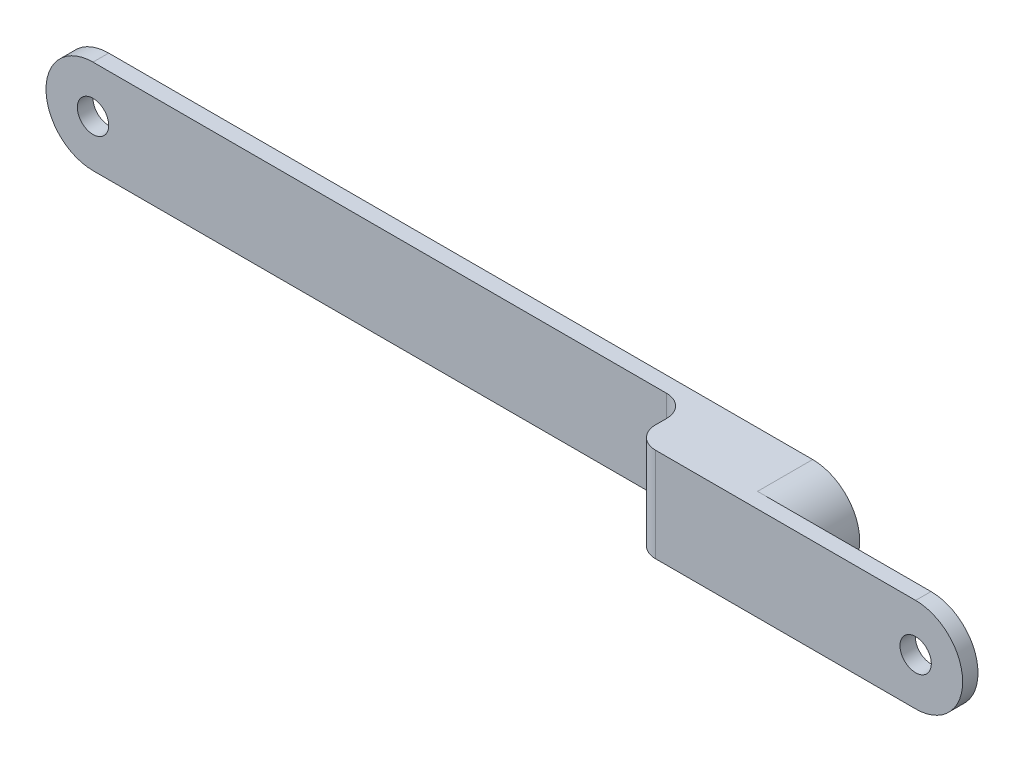
from build123d import *

# Parameters (mm, degrees)
BOSS_EXTRUDE1_DEPTH = 45
SKETCH2_R           = 5
CUT_EXTRUDE1_DEPTH  = 90
SKETCH7_OUTSIDE_W   = 279.254
SKETCH7_OUTSIDE_H   = 94.254
CUT_EXTRUDE2_DEPTH  = 50
FILLET1_R           = 7
BOSS_EXTRUDE2_DEPTH = 22.5
CUT_EXTRUDE3_START  = -17.6
SKETCH10_R          = 15
CUT_EXTRUDE3_DEPTH  = 17.6
FILLET3_START       = -1
FILLET3_DEPTH       = 18.6
CUT_EXTRUDE4_DEPTH  = 17.6
SKETCH12_R          = 5
CUT_EXTRUDE5_DEPTH  = 15


with BuildPart() as part:
    # Sketch1 → Boss-Extrude1 (new body)
    with BuildSketch(Plane.XY):
        with BuildLine():
            Line((0, 15), (200, 15))
            ThreePointArc((200, 15), (215, 0), (200, -15))
            Line((200, -15), (0, -15))
            ThreePointArc((0, -15), (-15, 0), (0, 15))
        make_face()
    extrude(amount=BOSS_EXTRUDE1_DEPTH)

    # Sketch2 → Cut-Extrude1 (cut)
    with BuildSketch(Plane.XY.offset(45)):
        Circle(SKETCH2_R)
    extrude(amount=-CUT_EXTRUDE1_DEPTH, mode=Mode.SUBTRACT)

    # Sketch7 outside → Cut-Extrude2 (cut)
    with BuildSketch(Plane.XZ.offset(15)):
        with Locations((100, 22.5)):
            Rectangle(SKETCH7_OUTSIDE_W, SKETCH7_OUTSIDE_H)
        Polygon((215, 22.5), (190, 22.5), (190, 5), (-15, 5), (-15, 0), (215, 0), align=None, mode=Mode.SUBTRACT)
    extrude(amount=-CUT_EXTRUDE2_DEPTH, mode=Mode.SUBTRACT)

    # Fillet1
    fillet1_edges = [part.edges().sort_by_distance(p)[0] for p in [
        (190, 0, 22.5),
        (190, 0, 5),
    ]]
    fillet(fillet1_edges, radius=FILLET1_R)

    # Sketch8 → Boss-Extrude2 (add)
    with BuildSketch(Plane.XY.offset(22.5)):
        with BuildLine():
            Line((200, 15), (280, 15))
            ThreePointArc((280, 15), (295, 0), (280, -15))
            Line((280, -15), (200, -15))
            Line((200, -15), (200, 15))
        make_face()
    extrude(amount=-BOSS_EXTRUDE2_DEPTH)

    # Sketch10 → Cut-Extrude3 (cut)
    with BuildSketch(Plane(origin=(0, 0, 0), x_dir=(-1, 0, 0), z_dir=(0, 0, -1)).offset(CUT_EXTRUDE3_START)):
        with Locations((-280, 0)):
            Circle(SKETCH10_R)
    extrude(amount=CUT_EXTRUDE3_DEPTH, mode=Mode.SUBTRACT)

    # Fillet3: read off the stored shape, not the designer's step
    # Fillet3 outline → Fillet3 (cut)
    with BuildSketch(Plane.XY.offset(FILLET3_START)):
        with BuildLine():
            ThreePointArc((280, -15), (271.538858878, -12.385842358), (266.026885319, -5.454545455))
            ThreePointArc((266.026885319, -5.454545455), (265.286158235, -11.948532524), (259.506098468, -15))
            Line((259.506098468, -15), (280, -15))
        make_face()
        with BuildLine():
            ThreePointArc((259.506098468, 15), (265.286158235, 11.948532524), (266.026885319, 5.454545455))
            ThreePointArc((266.026885319, 5.454545455), (271.538858878, 12.385842358), (280, 15))
            Line((280, 15), (259.506098468, 15))
        make_face()
    extrude(amount=FILLET3_DEPTH, mode=Mode.SUBTRACT)

    # Sketch11 → Cut-Extrude4 (cut)
    with BuildSketch(Plane(origin=(0, 0, 0), x_dir=(-1, 0, 0), z_dir=(0, 0, -1))):
        with BuildLine():
            Line((-224.645366828, -15), (-269.753049234, -15))
            Line((-269.753049234, -15), (-269.753049234, 15))
            Line((-269.753049234, 15), (-224.645366828, 15))
            ThreePointArc((-224.645366828, 15), (-239.645366828, 0), (-224.645366828, -15))
        make_face()
    extrude(amount=-CUT_EXTRUDE4_DEPTH, mode=Mode.SUBTRACT)

    # Sketch12 → Cut-Extrude5 (cut)
    with BuildSketch(Plane(origin=(0, 0, 17.6), x_dir=(-1, 0, 0), z_dir=(0, 0, -1))):
        with Locations((-280, 0)):
            Circle(SKETCH12_R)
    extrude(amount=-CUT_EXTRUDE5_DEPTH, mode=Mode.SUBTRACT)


solid = part.part
